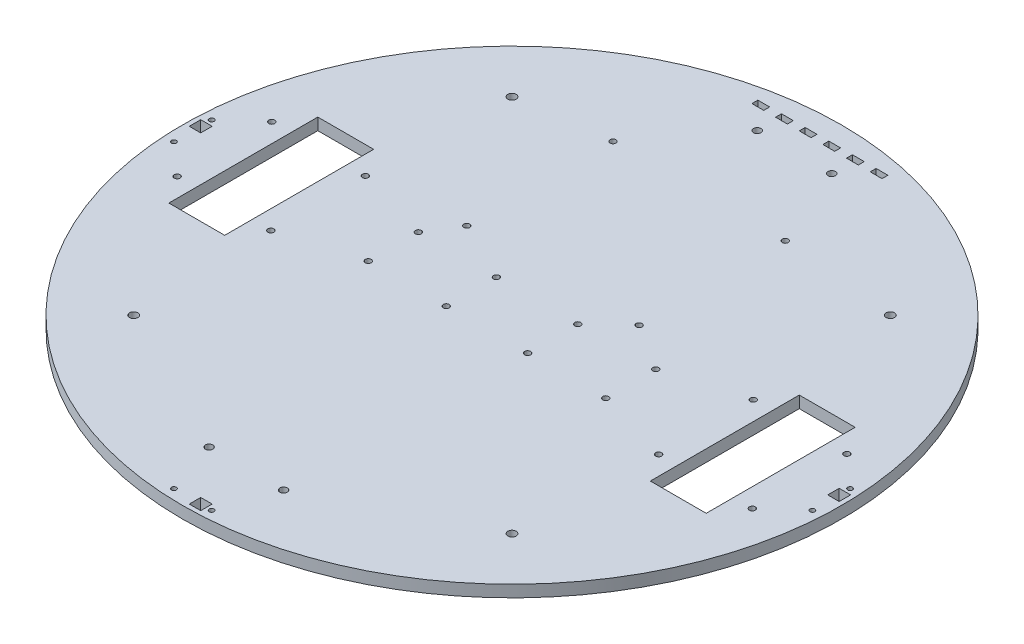
from build123d import *

# Parameters (mm, degrees)
SKETCH1_R           = 177
SKETCH1_R_2         = 1.6
SKETCH1_R_3         = 2.2479
SKETCH1_R_4         = 2.000000064
SKETCH1_R_5         = 1.3
SKETCH1_R_6         = 1.29999994
SKETCH1_W           = 6.15
SKETCH1_H           = 6.15
SKETCH1_W_2         = 30
SKETCH1_H_2         = 80
SKETCH1_W_3         = 6.35
SKETCH1_H_3         = 3.175
BOSS_EXTRUDE1_DEPTH = 6.35


with BuildPart() as part:
    # Sketch1 → Boss-Extrude1 (new body)
    with BuildSketch(Plane(origin=(0, 0, 0), x_dir=(1, 0, 0), z_dir=(0, 1, 0))):
        Circle(SKETCH1_R)
        with Locations((-154.46, 25.4)):
            Circle(SKETCH1_R_2, mode=Mode.SUBTRACT)
        with Locations((-154.46, -25.4)):
            Circle(SKETCH1_R_2, mode=Mode.SUBTRACT)
        with Locations((154.46, 25.4)):
            Circle(SKETCH1_R_2, mode=Mode.SUBTRACT)
        with Locations((154.46, -25.4)):
            Circle(SKETCH1_R_2, mode=Mode.SUBTRACT)
        with Locations((-104.14, 25.4)):
            Circle(SKETCH1_R_2, mode=Mode.SUBTRACT)
        with Locations((-104.14, -25.4)):
            Circle(SKETCH1_R_2, mode=Mode.SUBTRACT)
        with Locations((104.14, 25.4)):
            Circle(SKETCH1_R_2, mode=Mode.SUBTRACT)
        with Locations((104.14, -25.4)):
            Circle(SKETCH1_R_2, mode=Mode.SUBTRACT)
        with Locations((-53.7, 107.95)):
            Circle(SKETCH1_R_2, mode=Mode.SUBTRACT)
        with Locations((38.8, 107.95)):
            Circle(SKETCH1_R_2, mode=Mode.SUBTRACT)
        with Locations((-53.7, 29.45)):
            Circle(SKETCH1_R_2, mode=Mode.SUBTRACT)
        with Locations((38.8, 29.45)):
            Circle(SKETCH1_R_2, mode=Mode.SUBTRACT)
        with Locations((-101.6, -101.6)):
            Circle(SKETCH1_R_3, mode=Mode.SUBTRACT)
        with Locations((101.6, -101.6)):
            Circle(SKETCH1_R_3, mode=Mode.SUBTRACT)
        with Locations((-101.6, 101.6)):
            Circle(SKETCH1_R_3, mode=Mode.SUBTRACT)
        with Locations((101.6, 101.6)):
            Circle(SKETCH1_R_3, mode=Mode.SUBTRACT)
        with Locations((-20, -142.687006289)):
            Circle(SKETCH1_R_4, mode=Mode.SUBTRACT)
        with Locations((20, -142.687006289)):
            Circle(SKETCH1_R_4, mode=Mode.SUBTRACT)
        with Locations((-20, 151.719279026)):
            Circle(SKETCH1_R_4, mode=Mode.SUBTRACT)
        with Locations((20, 151.719279026)):
            Circle(SKETCH1_R_4, mode=Mode.SUBTRACT)
        with Locations((-10.125, -171.45)):
            Circle(SKETCH1_R_5, mode=Mode.SUBTRACT)
        with Locations((10.125, -171.45)):
            Circle(SKETCH1_R_6, mode=Mode.SUBTRACT)
        with Locations((171.45, -10.125)):
            Circle(SKETCH1_R_5, mode=Mode.SUBTRACT)
        with Locations((171.45, 10.125)):
            Circle(SKETCH1_R_5, mode=Mode.SUBTRACT)
        with Locations((-171.45, -10.125)):
            Circle(SKETCH1_R_5, mode=Mode.SUBTRACT)
        with Locations((-171.45, 10.125)):
            Circle(SKETCH1_R_5, mode=Mode.SUBTRACT)
        with Locations((-63.76, 13.473999986)):
            Circle(SKETCH1_R_2, mode=Mode.SUBTRACT)
        with Locations((-63.76, -13.450000014)):
            Circle(SKETCH1_R_2, mode=Mode.SUBTRACT)
        with Locations((-21.85, 13.473999986)):
            Circle(SKETCH1_R_2, mode=Mode.SUBTRACT)
        with Locations((-21.85, -13.450000014)):
            Circle(SKETCH1_R_2, mode=Mode.SUBTRACT)
        with Locations((63.76, -13.450000014)):
            Circle(SKETCH1_R_2, mode=Mode.SUBTRACT)
        with Locations((21.85, -13.450000014)):
            Circle(SKETCH1_R_2, mode=Mode.SUBTRACT)
        with Locations((21.85, 13.473999986)):
            Circle(SKETCH1_R_2, mode=Mode.SUBTRACT)
        with Locations((63.76, 13.473999986)):
            Circle(SKETCH1_R_2, mode=Mode.SUBTRACT)
        with Locations((171.45, 4.26)):
            Rectangle(SKETCH1_W, SKETCH1_H, mode=Mode.SUBTRACT)
        with Locations((-129.3, 0)):
            Rectangle(SKETCH1_W_2, SKETCH1_H_2, mode=Mode.SUBTRACT)
        with Locations((129.3, 0)):
            Rectangle(SKETCH1_W_2, SKETCH1_H_2, mode=Mode.SUBTRACT)
        with Locations((4.26, -171.45)):
            Rectangle(SKETCH1_W, SKETCH1_H, mode=Mode.SUBTRACT)
        with Locations((-171.45, 4.26)):
            Rectangle(SKETCH1_W, SKETCH1_H, mode=Mode.SUBTRACT)
        with Locations((-18.119952608, 164.452014647)):
            Rectangle(SKETCH1_W_3, SKETCH1_H_3, mode=Mode.SUBTRACT)
        with Locations((-30.819952608, 164.452014647)):
            Rectangle(SKETCH1_W_3, SKETCH1_H_3, mode=Mode.SUBTRACT)
        with Locations((-5.419952608, 164.452014647)):
            Rectangle(SKETCH1_W_3, SKETCH1_H_3, mode=Mode.SUBTRACT)
        with Locations((7.280047392, 164.452014647)):
            Rectangle(SKETCH1_W_3, SKETCH1_H_3, mode=Mode.SUBTRACT)
        with Locations((19.980047392, 164.452014647)):
            Rectangle(SKETCH1_W_3, SKETCH1_H_3, mode=Mode.SUBTRACT)
        with Locations((32.680047392, 164.452014647)):
            Rectangle(SKETCH1_W_3, SKETCH1_H_3, mode=Mode.SUBTRACT)
    extrude(amount=BOSS_EXTRUDE1_DEPTH)


solid = part.part
